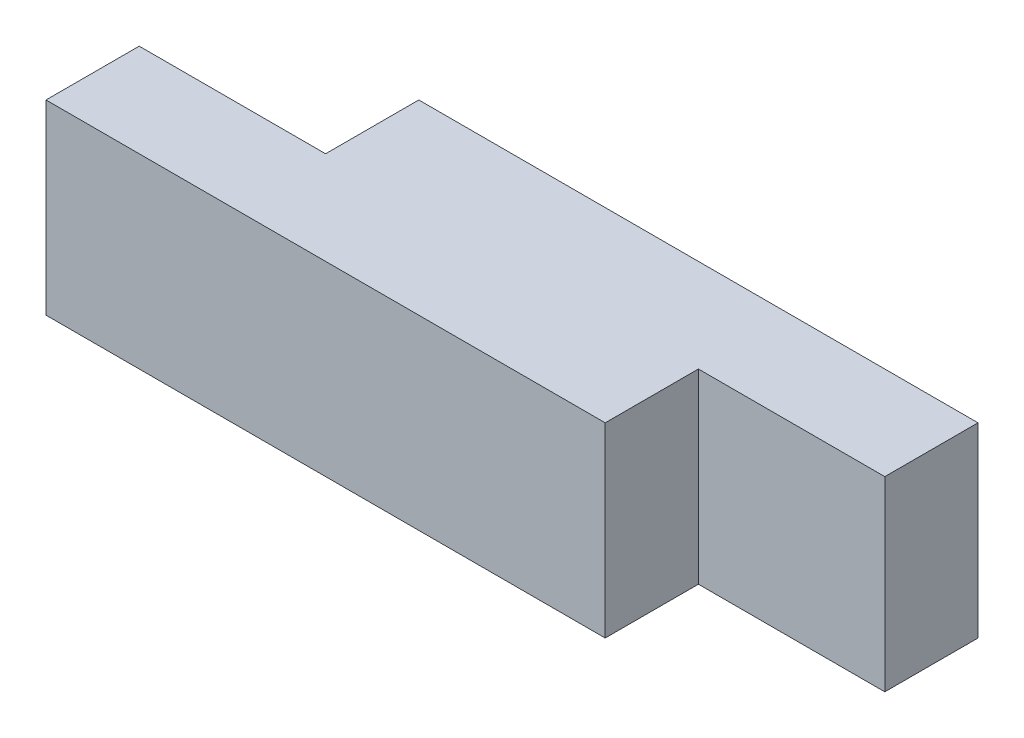
from build123d import *

# Parameters (mm, degrees)
CROQUIS1_W              = 80
CROQUIS1_H              = 20
SALIENTE_EXTRUIR1_DEPTH = 20
CROQUIS2_W              = 20
CROQUIS2_H              = 20
CORTAR_EXTRUIR1_DEPTH   = 10
CROQUIS3_W              = 20
CROQUIS3_H              = 20
CORTAR_EXTRUIR2_DEPTH   = 10


with BuildPart() as part:
    # Croquis1 → Saliente-Extruir1 (new body)
    with BuildSketch(Plane.XY):
        Rectangle(CROQUIS1_W, CROQUIS1_H)
    extrude(amount=SALIENTE_EXTRUIR1_DEPTH)

    # Croquis2 → Cortar-Extruir1 (cut)
    with BuildSketch(Plane.XY.offset(20)):
        with Locations((30, 0)):
            Rectangle(CROQUIS2_W, CROQUIS2_H)
    extrude(amount=-CORTAR_EXTRUIR1_DEPTH, mode=Mode.SUBTRACT)

    # Croquis3 → Cortar-Extruir2 (cut)
    with BuildSketch(Plane(origin=(0, 0, 0), x_dir=(-1, 0, 0), z_dir=(0, 0, -1))):
        with Locations((30, 0)):
            Rectangle(CROQUIS3_W, CROQUIS3_H)
    extrude(amount=-CORTAR_EXTRUIR2_DEPTH, mode=Mode.SUBTRACT)


solid = part.part
